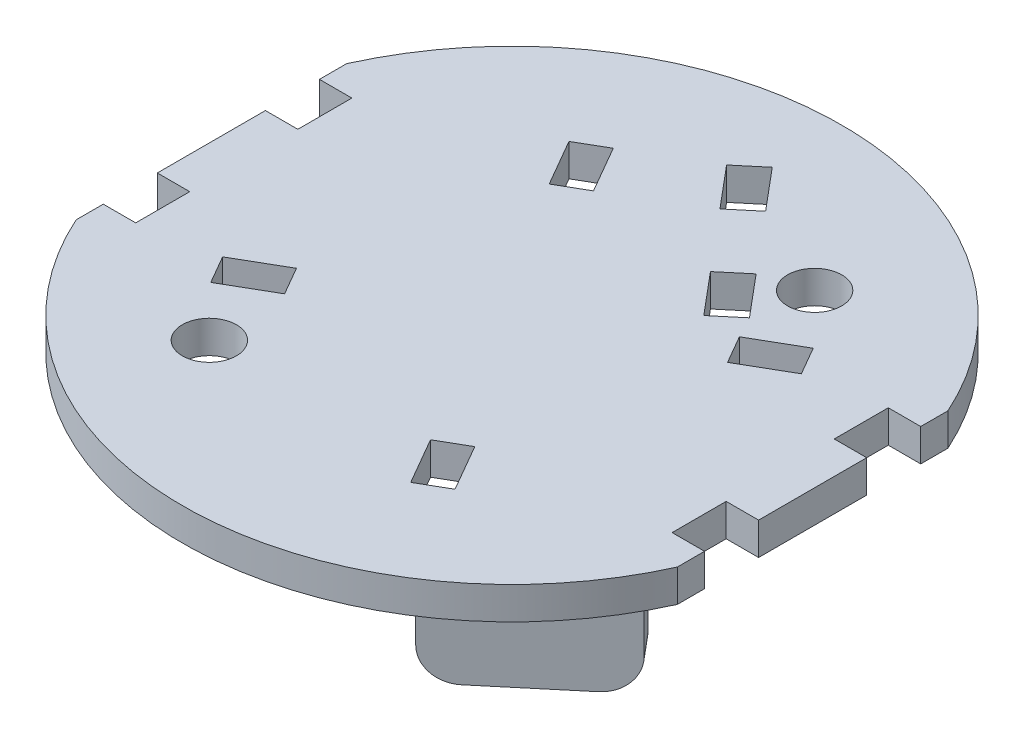
from build123d import *

# Parameters (mm, degrees)
CROQUIS1_R              = 30.5
SALIENTE_EXTRUIR1_DEPTH = 3
CORTAR_EXTRUIR3_START   = -4
CORTAR_EXTRUIR3_DEPTH   = 4
CORTAR_EXTRUIR6_DEPTH   = 10
CROQUIS10_R             = 2.5
CORTAR_EXTRUIR7_DEPTH   = 10
CORTAR_EXTRUIR8_START   = -3
CORTAR_EXTRUIR8_DEPTH   = 3
SALIENTE_EXTRUIR2_DEPTH = 10
REDONDEO1_R             = 3
REDONDEO2_R             = 1
CORTAR_EXTRUIR9_DEPTH   = 3


with BuildPart() as part:
    # Croquis1 → Saliente-Extruir1 (new body)
    with BuildSketch(Plane(origin=(0, 0, 0), x_dir=(1, 0, 0), z_dir=(0, 1, 0))):
        Circle(CROQUIS1_R)
    extrude(amount=SALIENTE_EXTRUIR1_DEPTH)

    # Croquis5 → Cortar-Extruir3 (cut)
    with BuildSketch(Plane(origin=(0, 3, 0), x_dir=(1, 0, 0), z_dir=(0, 1, 0)).offset(CORTAR_EXTRUIR3_START)):
        with BuildLine():
            Line((30.087372767, -5), (24.814059068, -5))
            Line((24.814059068, -5), (24.814059068, -10))
            Line((24.814059068, -10), (28.814059068, -10))
            ThreePointArc((28.814059068, -10), (29.556634924, -7.526973624), (30.087372767, -5))
        make_face()
        with BuildLine():
            Line((24.814059068, 5), (30.087372767, 5))
            ThreePointArc((30.087372767, 5), (29.556634924, 7.526973624), (28.814059068, 10))
            Line((28.814059068, 10), (24.814059068, 10))
            Line((24.814059068, 10), (24.814059068, 5))
        make_face()
        with BuildLine():
            ThreePointArc((-30.087372767, -5), (-29.556634924, -7.526973624), (-28.814059068, -10))
            Line((-28.814059068, -10), (-24.814059068, -10))
            Line((-24.814059068, -10), (-24.814059068, -5))
            Line((-24.814059068, -5), (-30.087372767, -5))
        make_face()
        with BuildLine():
            Line((-24.814059068, 10), (-28.814059068, 10))
            ThreePointArc((-28.814059068, 10), (-29.556634924, 7.526973624), (-30.087372767, 5))
            Line((-30.087372767, 5), (-24.814059068, 5))
            Line((-24.814059068, 5), (-24.814059068, 10))
        make_face()
    extrude(amount=CORTAR_EXTRUIR3_DEPTH, mode=Mode.SUBTRACT)

    # Croquis9 → Cortar-Extruir6 (cut)
    with BuildSketch(Plane(origin=(0, 3, 0), x_dir=(1, 0, 0), z_dir=(0, 1, 0))):
        Polygon((7.971418181, 14.613753061), (5.673284852, 12.685390231), (8.887222901, 8.855168016), (11.18535623, 10.783530845), align=None)
        Polygon((0.177618414, 23.902041933), (-2.120514915, 21.973679104), (1.093423133, 18.143456889), (3.391556462, 20.071819718), align=None)
    extrude(amount=-CORTAR_EXTRUIR6_DEPTH, mode=Mode.SUBTRACT)

    # Croquis10 → Cortar-Extruir7 (cut)
    with BuildSketch(Plane(origin=(0, 3, 0), x_dir=(1, 0, 0), z_dir=(0, 1, 0))):
        with Locations((12, 16)):
            Circle(CROQUIS10_R)
        with Locations((-12, -16)):
            Circle(CROQUIS10_R)
    extrude(amount=-CORTAR_EXTRUIR7_DEPTH, mode=Mode.SUBTRACT)

    # Croquis11 → Cortar-Extruir8 (cut)
    with BuildSketch(Plane(origin=(0, 3, 0), x_dir=(1, 0, 0), z_dir=(0, 1, 0)).offset(CORTAR_EXTRUIR8_START)):
        with BuildLine():
            Line((30.087372767, 5), (27.814059068, 5))
            Line((27.814059068, 5), (27.814059068, -5))
            Line((27.814059068, -5), (30.087372767, -5))
            ThreePointArc((30.087372767, -5), (30.5, 0), (30.087372767, 5))
        make_face()
        with BuildLine():
            Line((-27.814059068, -5), (-27.814059068, 5))
            Line((-27.814059068, 5), (-30.087372767, 5))
            ThreePointArc((-30.087372767, 5), (-30.5, 0), (-30.087372767, -5))
            Line((-30.087372767, -5), (-27.814059068, -5))
        make_face()
        with BuildLine():
            Line((27.814059068, 12.515115586), (27.814059068, 10))
            Line((27.814059068, 10), (28.814059068, 10))
            ThreePointArc((28.814059068, 10), (28.341972277, 11.268655974), (27.814059068, 12.515115586))
        make_face()
        with BuildLine():
            Line((-27.814059068, 10), (-27.814059068, 12.515115586))
            ThreePointArc((-27.814059068, 12.515115586), (-28.341972277, 11.268655974), (-28.814059068, 10))
            Line((-28.814059068, 10), (-27.814059068, 10))
        make_face()
        with BuildLine():
            ThreePointArc((-28.814059068, -10), (-28.341972277, -11.268655974), (-27.814059068, -12.515115586))
            Line((-27.814059068, -12.515115586), (-27.814059068, -10))
            Line((-27.814059068, -10), (-28.814059068, -10))
        make_face()
        with BuildLine():
            Line((28.814059068, -10), (27.814059068, -10))
            Line((27.814059068, -10), (27.814059068, -12.515115586))
            ThreePointArc((27.814059068, -12.515115586), (28.341972277, -11.268655974), (28.814059068, -10))
        make_face()
    extrude(amount=CORTAR_EXTRUIR8_DEPTH, mode=Mode.SUBTRACT)

    # Croquis13 → Saliente-Extruir2 (add)
    with BuildSketch(Plane.XZ):
        Polygon((-6.816688183, 4.321977983), (-19.672440377, -10.99891088), (-17.374307048, -12.927273709), (-4.518554854, 2.393615154), align=None)
        Polygon((21.527275636, 8.931176939), (23.455638465, 11.229310268), (11.964971818, 20.871124414), (10.036608989, 18.572991084), align=None)
    extrude(amount=SALIENTE_EXTRUIR2_DEPTH)

    # Redondeo1
    redondeo1_edges = [part.edges().sort_by_distance(p)[0] for p in [
        (11.000790403, -10, 19.722057749),
        (22.49145705, -10, 10.080243604),
        (-5.667621519, -10, 3.357796568),
        (-18.523373712, -10, -11.963092294),
    ]]
    fillet(redondeo1_edges, radius=REDONDEO1_R)

    # Redondeo2
    redondeo2_edges = [part.edges().sort_by_distance(p)[0] for p in [
        (17.710305141, 0, 16.050217341),
        (11.000790403, 0, 19.722057749),
        (-5.667621519, 0, 3.357796568),
        (-13.24456428, 0, -3.338466449),
        (22.49145705, 0, 10.080243604),
        (-18.523373712, 0, -11.963092294),
    ]]
    fillet(redondeo2_edges, radius=REDONDEO2_R)

    # Croquis12 → Cortar-Extruir9 (cut)
    with BuildSketch(Plane(origin=(0, 3, 0), x_dir=(1, 0, 0), z_dir=(0, 1, 0))):
        Polygon((13.740381057, 6.200961894), (18.070508076, 8.700961894), (16.570508076, 11.299038106), (12.240381057, 8.799038106), align=None)
        Polygon((11.299038106, -16.570508076), (8.799038106, -12.240381057), (6.200961894, -13.740381057), (8.700961894, -18.070508076), align=None)
        Polygon((-16.570508076, -11.299038106), (-12.240381057, -8.799038106), (-13.740381057, -6.200961894), (-18.070508076, -8.700961894), align=None)
        Polygon((-8.799038106, 12.240381057), (-6.200961894, 13.740381057), (-8.700961894, 18.070508076), (-11.299038106, 16.570508076), align=None)
    extrude(amount=-CORTAR_EXTRUIR9_DEPTH, mode=Mode.SUBTRACT)


solid = part.part
